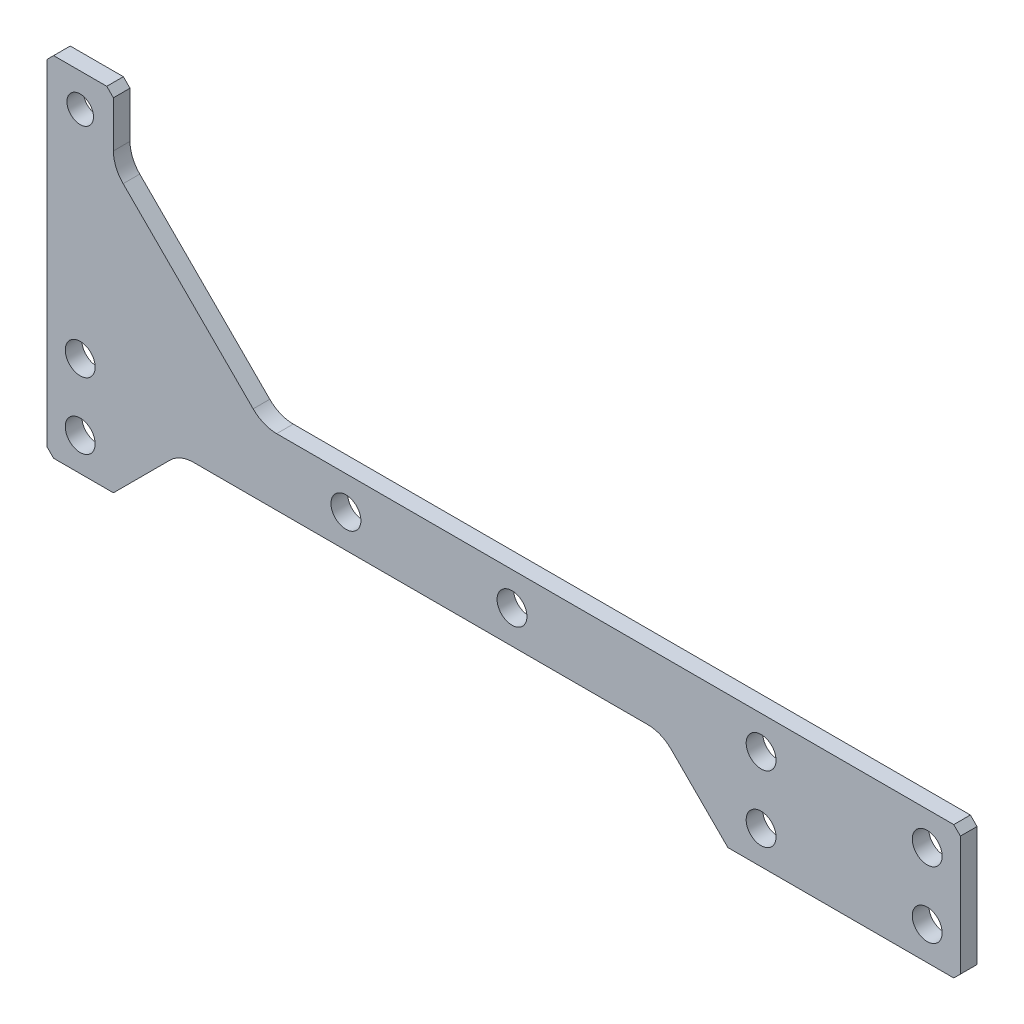
from build123d import *

# Parameters (mm, degrees)
SKETCH_1_R          = 4.5
SKETCH_1_R_2        = 4
EXTRUDE_1_DEPTH     = 5
CHAMFER_2_SIZE      = 20
CHAMFER_3_SIZE      = 20
SKETCH_2_R          = 4.5
CUT_EXTRUDE_1_DEPTH = 5
FILLET_1_R          = 10
CHAMFER_4_SIZE      = 2
SKETCH_3_R          = 4.5
CUT_EXTRUDE_2_DEPTH = 10


with BuildPart() as part:
    # 草图1 → 凸台-拉伸1 (new body)
    with BuildSketch(Plane.XY):
        Polygon((-215, 70), (-215, 75), (-215, 95), (-195, 95), (-195, 75), (-150, 30), (60, 30), (60, 10), (60, -10), (40, -10), (10, -10), (-10, -10), (-10, 10), (-195, 10), (-195, -10), (-215, -10), (-215, 10), align=None)
        Circle(SKETCH_1_R, mode=Mode.SUBTRACT)
        with Locations((50, 0)):
            Circle(SKETCH_1_R, mode=Mode.SUBTRACT)
        with Locations((-205, 20)):
            Circle(SKETCH_1_R, mode=Mode.SUBTRACT)
        with Locations((0, 20)):
            Circle(SKETCH_1_R, mode=Mode.SUBTRACT)
        with Locations((-205, 0)):
            Circle(SKETCH_1_R, mode=Mode.SUBTRACT)
        with Locations((-205, 85)):
            Circle(SKETCH_1_R_2, mode=Mode.SUBTRACT)
    extrude(amount=EXTRUDE_1_DEPTH)

    # 倒角2
    chamfer_2_edges = [part.edges().sort_by_distance(p)[0] for p in [
        (-10, 10, 2.5),
    ]]
    chamfer(chamfer_2_edges, length=CHAMFER_2_SIZE - 0.0001)  # a hair under: the kernel refuses the full size

    # 倒角3
    chamfer_3_edges = [part.edges().sort_by_distance(p)[0] for p in [
        (-195, 10, 2.5),
    ]]
    chamfer(chamfer_3_edges, length=CHAMFER_3_SIZE - 0.0001)  # a hair under: the kernel refuses the full size

    # 草图2 → 切除-拉伸1 (cut)
    with BuildSketch(Plane.XY.offset(5)):
        with Locations((-125, 19.986)):
            Circle(SKETCH_2_R)
        with Locations((-75, 19.986)):
            Circle(SKETCH_2_R)
    extrude(amount=-CUT_EXTRUDE_1_DEPTH, mode=Mode.SUBTRACT)

    # 圆角1
    fillet_1_edges = [part.edges().sort_by_distance(p)[0] for p in [
        (-195, 75, 2.5),
        (-150, 30, 2.5),
        (-29.9999, 10, 2.5),
        (-175.0001, 10, 2.5),
    ]]
    fillet(fillet_1_edges, radius=FILLET_1_R)

    # 倒角4
    chamfer_4_edges = [part.edges().sort_by_distance(p)[0] for p in [
        (60, 30, 2.5),
        (60, -10, 2.5),
        (-215, -10, 2.5),
        (-215, 95, 2.5),
        (-195, 95, 2.5),
    ]]
    chamfer(chamfer_4_edges, length=CHAMFER_4_SIZE)

    # 草图3 → 切除-拉伸2 (cut)
    with BuildSketch(Plane.XY.offset(5)):
        with Locations((50, 20)):
            Circle(SKETCH_3_R)
    extrude(amount=-CUT_EXTRUDE_2_DEPTH, mode=Mode.SUBTRACT)


solid = part.part
